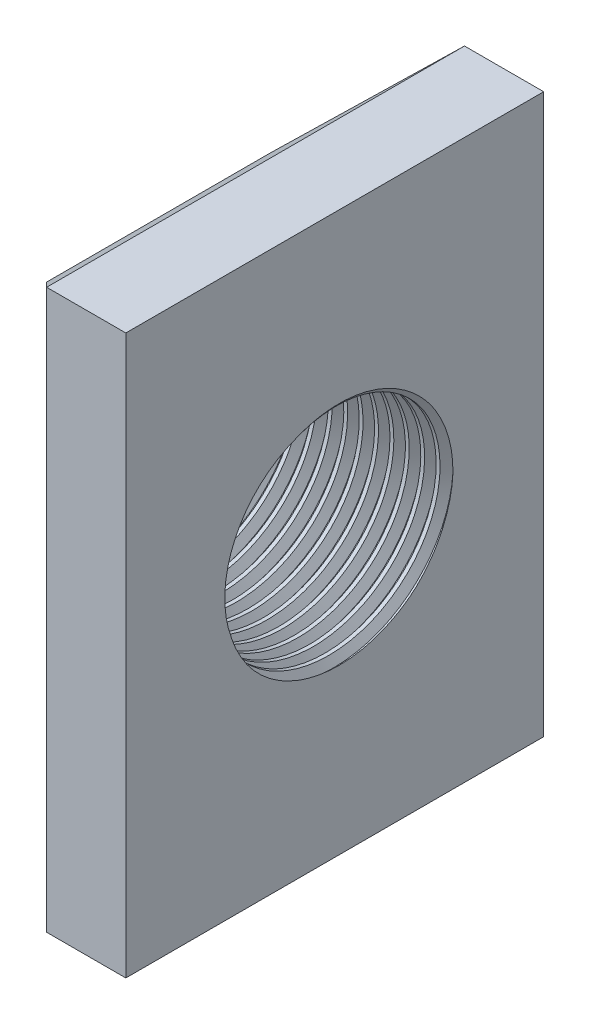
from build123d import *

# Parameters (mm, degrees)
BOSS_EXTRUDE1_DEPTH = 4.75
CHAMFER1_SIZE       = 2.2
CHAMFER2_SIZE       = 2.2
SKETCH2_R           = 2.5
CUT_EXTRUDE1_DEPTH  = 9.884941505
THREAD1_PITCH       = 0.35


with BuildPart() as part:
    # Sketch1 → Boss-Extrude1 (new, symmetric)
    with BuildSketch(Plane.XY):
        Polygon((0, -6.35), (0, 6.35), (-1.8, 6.35), (-4.007141817, 4.245), (-4.007141817, -4.245), (-1.8, -6.35), align=None)
    extrude(amount=BOSS_EXTRUDE1_DEPTH, both=True)

    # Chamfer1
    chamfer1_edges = [part.edges().sort_by_distance(p)[0] for p in [
        (-4.007141817, 0, 4.75),
    ]]
    chamfer(chamfer1_edges, length=CHAMFER1_SIZE)

    # Chamfer2
    chamfer2_edges = [part.edges().sort_by_distance(p)[0] for p in [
        (-4.007141817, 0, -4.75),
    ]]
    chamfer(chamfer2_edges, length=CHAMFER2_SIZE)

    # Sketch2 → Cut-Extrude1 (cut, through all)
    with BuildSketch(Plane(origin=(0, 0, 0), x_dir=(0, 0, -1), z_dir=(1, 0, 0))):
        Circle(SKETCH2_R)
    extrude(amount=-CUT_EXTRUDE1_DEPTH, mode=Mode.SUBTRACT)

    # Thread1: the profile of Thread Profile1 profile screwed along a right-hand helix of 28.571429 turns, 6 arcs to a turn; built about Z, then put on its axis
    thread1_z = Axis((0, 0, 0), (0, 0, 1))
    thread1_corners = [(2.4997, 0, -0.000173205), (2.689443056, 0, 0.109375), (2.689443056, 0, 0.153125), (2.4997, 0, 0.262673204)]
    with BuildLine(mode=Mode.PRIVATE) as thread1_profile:
        Line(thread1_corners[0], thread1_corners[1])
        Line(thread1_corners[1], thread1_corners[2])
        Line(thread1_corners[2], thread1_corners[3])
        Line(thread1_corners[3], thread1_corners[0])
    thread1_cap = Face(thread1_profile.wire())
    thread1_turn_angles = [0, 30, 60, 90, 120, 150, 180, 210, 240, 270, 300, 330, 360]
    thread1_turn_weights = [1, 0.8660254037844387, 1, 0.8660254037844387, 1, 0.8660254037844387, 1, 0.8660254037844387, 1, 0.8660254037844387, 1, 0.8660254037844387, 1]
    thread1_turn_rails = [Edge.make_bspline([Vector(p[0], p[1], 0).rotate(thread1_z, thread1_turn_angles[k]) / thread1_turn_weights[k] + Vector(0, 0, p[2] + THREAD1_PITCH * thread1_turn_angles[k] / 360) for k in range(13)], [0, 0, 0, 1, 1, 2, 2, 3, 3, 4, 4, 5, 5, 6, 6, 6], 2, thread1_turn_weights) for p in thread1_corners]
    thread1_turn_sides = [Face.make_surface_from_curves(thread1_turn_rails[p[0]], thread1_turn_rails[p[1]]) for p in [(0, 1), (1, 2), (2, 3), (3, 0)]]
    thread1_last_angles = [10080, 10110, 10140, 10170, 10200, 10230, 10260, 10272.857142857, 10285.714285714]
    thread1_last_weights = [1, 0.8660254037844387, 1, 0.8660254037844387, 1, 0.8660254037844387, 1, 0.9749279121818226, 1]
    thread1_last_rails = [Edge.make_bspline([Vector(p[0], p[1], 0).rotate(thread1_z, thread1_last_angles[k]) / thread1_last_weights[k] + Vector(0, 0, p[2] + THREAD1_PITCH * thread1_last_angles[k] / 360) for k in range(9)], [0, 0, 0, 1, 1, 2, 2, 3, 3, 4, 4, 4], 2, thread1_last_weights) for p in thread1_corners]
    thread1_last_sides = [Face.make_surface_from_curves(thread1_last_rails[p[0]], thread1_last_rails[p[1]]) for p in [(0, 1), (1, 2), (2, 3), (3, 0)]]
    thread1 = Plane(origin=(-5.007141817, 0, 0), x_dir=(0, 0, -1), z_dir=(1, 0, 0)) * Solid(Shell([*[p.moved(Location((0, 0, THREAD1_PITCH * i))) for i in range(28) for p in thread1_turn_sides], *thread1_last_sides, thread1_cap, thread1_cap.rotate(thread1_z, 10285.714285714).moved(Location((0, 0, THREAD1_PITCH * 10285.714285714 / 360)))]))
    add(thread1, mode=Mode.SUBTRACT)


solid = part.part
